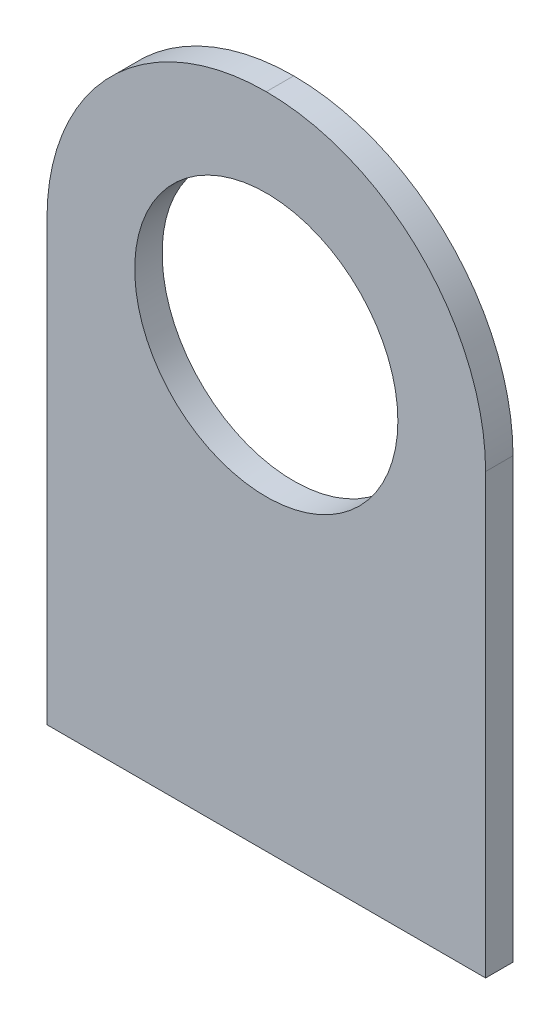
from build123d import *

# Parameters (mm, degrees)
SKETCH1_W           = 50.8
SKETCH1_H           = 76.2
SKETCH1_R           = 15.24
BOSS_EXTRUDE1_DEPTH = 3.175
FILLET1_R           = 25.4


with BuildPart() as part:
    # Sketch1 → Boss-Extrude1 (new body)
    with BuildSketch(Plane.XY):
        with Locations((-76.925714286, -40.930285714)):
            Rectangle(SKETCH1_W, SKETCH1_H)
        with Locations((-76.925714286, -28.230285714)):
            Circle(SKETCH1_R, mode=Mode.SUBTRACT)
    extrude(amount=BOSS_EXTRUDE1_DEPTH)

    # Fillet1
    fillet1_edges = [part.edges().sort_by_distance(p)[0] for p in [
        (-102.325714286, -2.830285714, 1.5875),
        (-51.525714286, -2.830285714, 1.5875),
    ]]
    fillet(fillet1_edges, radius=FILLET1_R - 0.0001)  # a hair under: the kernel refuses the full size


solid = part.part
